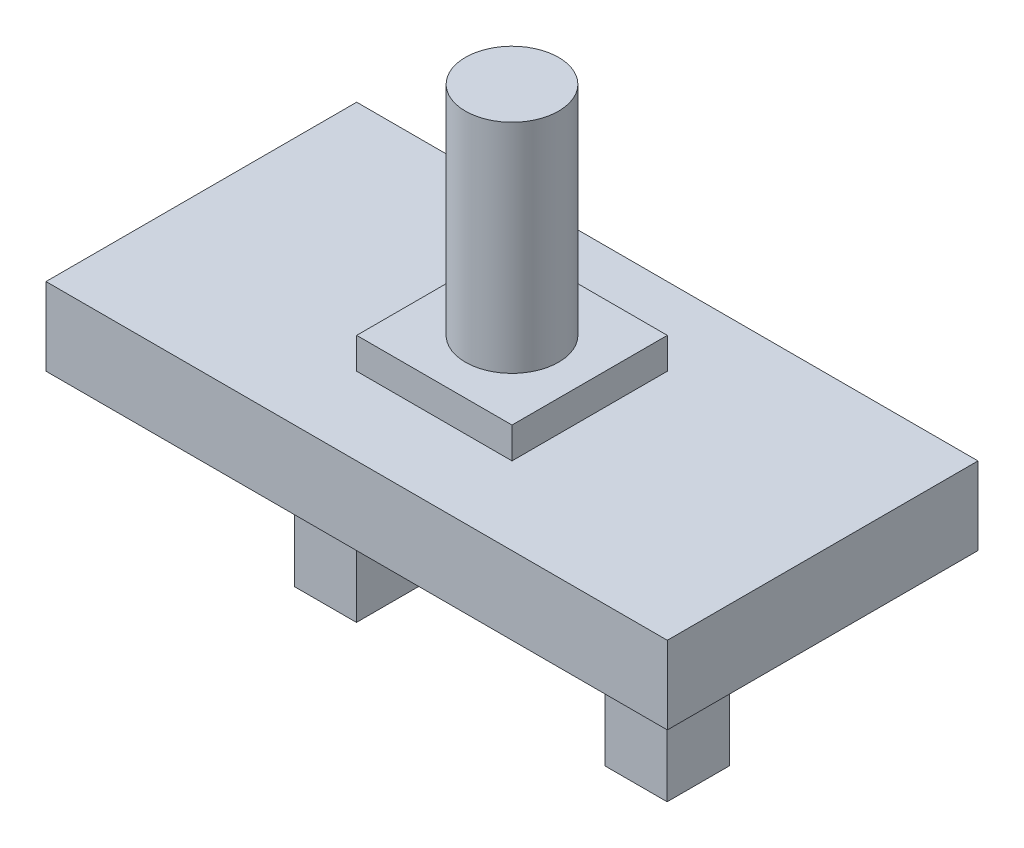
from build123d import *

# Parameters (mm, degrees)
SKETCH2_W           = 2000
SKETCH2_H           = 1000
BOSS_EXTRUDE1_DEPTH = 250
SKETCH3_W           = 500
SKETCH3_H           = 503.161668984
BOSS_EXTRUDE2_DEPTH = 100
SKETCH4_W           = 200
SKETCH4_H           = 201.264667594
BOSS_EXTRUDE3_DEPTH = 500
SKETCH5_W           = 200
SKETCH5_H           = 201.264667594
BOSS_EXTRUDE4_DEPTH = 500
SKETCH6_W           = 500
SKETCH6_H           = 500
BOSS_EXTRUDE5_DEPTH = 100
SKETCH7_R           = 150
BOSS_EXTRUDE6_DEPTH = 700


with BuildPart() as part:
    # Sketch2 → Boss-Extrude1 (new body)
    with BuildSketch(Plane(origin=(0, 0, 0), x_dir=(1, 0, 0), z_dir=(0, 1, 0))):
        Rectangle(SKETCH2_W, SKETCH2_H)
    extrude(amount=BOSS_EXTRUDE1_DEPTH)

    # Sketch3 → Boss-Extrude2 (add)
    with BuildSketch(Plane.XZ):
        with Locations((-500, 0)):
            Rectangle(SKETCH3_W, SKETCH3_H)
        with Locations((500, 0)):
            Rectangle(SKETCH3_W, SKETCH3_H)
    extrude(amount=BOSS_EXTRUDE2_DEPTH)

    # Sketch4 → Boss-Extrude3 (add)
    with BuildSketch(Plane.XZ.offset(100)):
        with Locations((500, 0)):
            Rectangle(SKETCH4_W, SKETCH4_H)
    extrude(amount=BOSS_EXTRUDE3_DEPTH)

    # Sketch5 → Boss-Extrude4 (add)
    with BuildSketch(Plane.XZ.offset(100)):
        with Locations((-500, 0)):
            Rectangle(SKETCH5_W, SKETCH5_H)
    extrude(amount=BOSS_EXTRUDE4_DEPTH)

    # Sketch6 → Boss-Extrude5 (add)
    with BuildSketch(Plane(origin=(0, 250, 0), x_dir=(1, 0, 0), z_dir=(0, 1, 0))):
        Rectangle(SKETCH6_W, SKETCH6_H)
    extrude(amount=BOSS_EXTRUDE5_DEPTH)

    # Sketch7 → Boss-Extrude6 (add)
    with BuildSketch(Plane(origin=(0, 350, 0), x_dir=(1, 0, 0), z_dir=(0, 1, 0))):
        Circle(SKETCH7_R)
    extrude(amount=BOSS_EXTRUDE6_DEPTH)


solid = part.part
